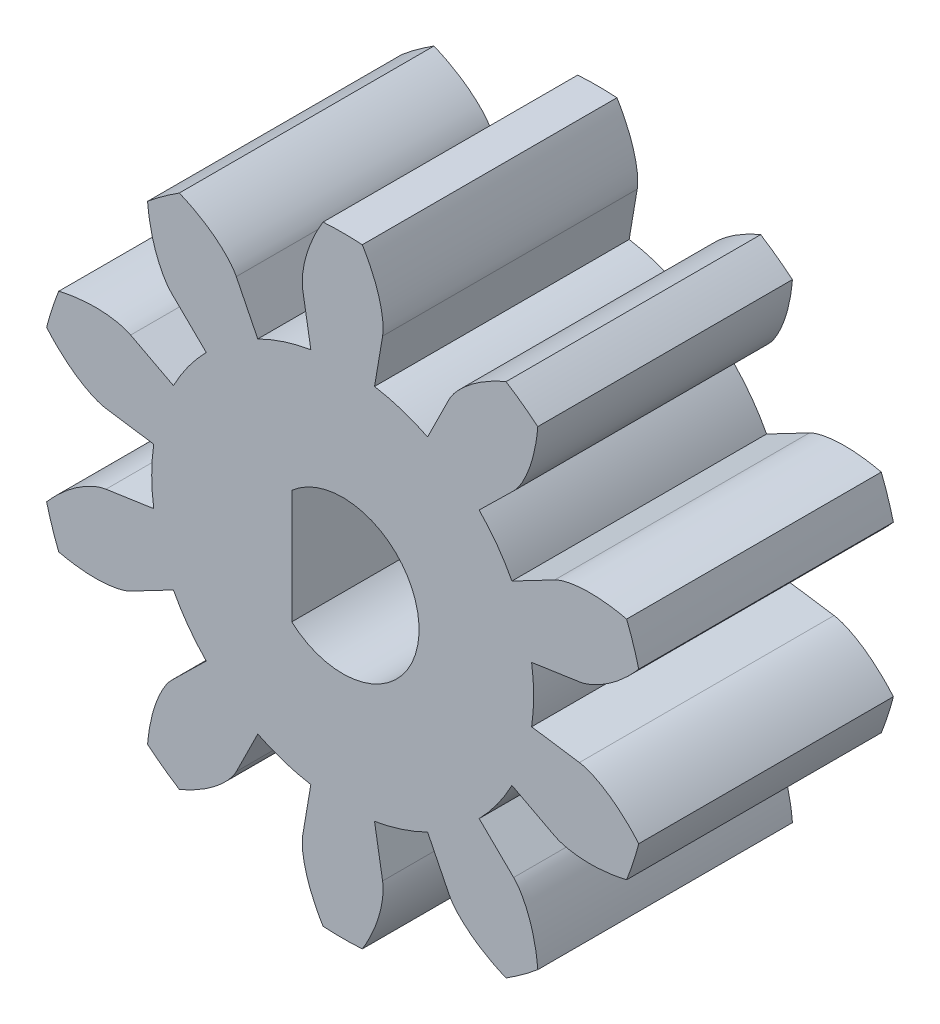
from build123d import *

# Parameters (mm, degrees)
SKETCH_1_R               = 6
SKETCH_1_R_2             = 1.25
EXTRUDE_1_DEPTH          = 5
CUT_EXTRUDE_1_DEPTH      = 10.848857802
PATTERN_CIRCULAR_1_DEPTH = 5
EXTRUDE_START            = -5
SKETCH_2_R               = 1.25
EXTRUDE_3_DEPTH          = 5
CUT_EXTRUDE_2_DEPTH      = 10.736429646


# Read off the part's stored shape, not the designer's step: 阵列(圆周)1
with BuildPart() as part:
    # 草图1 → 凸台-拉伸1 (new body)
    with BuildSketch(Plane.XY):
        Circle(SKETCH_1_R)
        Circle(SKETCH_1_R_2, mode=Mode.SUBTRACT)
    extrude(amount=EXTRUDE_1_DEPTH)

    # 草图1<3> → 切除-拉伸1 (cut, through all)
    with BuildSketch(Plane.XY):
        with BuildLine():
            Line((4.648088484, 0.686169791), (3.709794337, 0.54765498))
            ThreePointArc((3.709794337, 0.54765498), (3.739935077, 0.274564415), (3.75, 0))
            ThreePointArc((3.75, 0), (3.739935077, -0.274564415), (3.709794337, -0.54765498))
            Line((3.709794337, -0.54765498), (4.648088484, -0.686169791))
            add(Edge.make_bspline(
                [(4.648088484, -0.686169791), (4.683519606, -0.691400277), (4.781309106, -0.713360714), (4.960006956, -0.784137383), (5.231114785, -0.93748748), (5.485686634, -1.139450354), (5.670129672, -1.321731466), (5.782028037, -1.447201978), (5.813609798, -1.483893904)],
                knots=[0, 0, 0, 0, 0, 0.005604068, 0.015718248, 0.029959916, 0.048733667, 0.056327564, 0.056327564, 0.056327564, 0.056327564, 0.056327564], degree=4))
            ThreePointArc((5.813609798, -1.483893904), (5.953220086, -0.74777711), (6, 0))
            ThreePointArc((6, 0), (5.953220086, 0.74777711), (5.813609798, 1.483893904))
            add(Edge.make_bspline(
                [(4.648088484, 0.686169791), (4.683519606, 0.691400277), (4.781309106, 0.713360714), (4.960006956, 0.784137383), (5.231114785, 0.93748748), (5.485686634, 1.139450354), (5.670129672, 1.321731466), (5.782028037, 1.447201978), (5.813609798, 1.483893904)],
                knots=[0, 0, 0, 0, 0, 0.005604068, 0.015718248, 0.029959916, 0.048733667, 0.056327564, 0.056327564, 0.056327564, 0.056327564, 0.056327564], degree=4))
        make_face()
    extrude(amount=CUT_EXTRUDE_1_DEPTH, mode=Mode.SUBTRACT)

    # 阵列(圆周)1 outline → 阵列(圆周)1 (cut)
    with BuildSketch(Plane.XY):
        with BuildLine():
            Line((3.323190185, 1.737500215), (4.163703059, 2.176954841))
            add(Edge.make_bspline(
                [(4.163703059, 2.176954841), (4.195441841, 2.193549179), (4.287463229, 2.233262038), (4.473634309, 2.281038471), (4.783102075, 2.31632882), (5.107765826, 2.302571002), (5.364125528, 2.263515382), (5.528402923, 2.227779814), (5.575520078, 2.216658716)],
                knots=[0, 0, 0, 0, 0, 0.005604068, 0.015718248, 0.029959916, 0.048733667, 0.056327564, 0.056327564, 0.056327564, 0.056327564, 0.056327564], degree=4))
            ThreePointArc((5.575520078, 2.216658716), (4.854101966, 3.526711514), (3.831098172, 4.617649488))
            add(Edge.make_bspline(
                [(3.357062092, 3.287200884), (3.382652068, 3.312258327), (3.448857414, 3.38750392), (3.55182553, 3.549799409), (3.681019445, 3.833215427), (3.768261599, 4.146240403), (3.810337002, 4.402121818), (3.827114964, 4.569401803), (3.831098172, 4.617649488)],
                knots=[0, 0, 0, 0, 0, 0.005604068, 0.015718248, 0.029959916, 0.048733667, 0.056327564, 0.056327564, 0.056327564, 0.056327564, 0.056327564], degree=4))
            Line((3.357062092, 3.287200884), (2.679383144, 2.623624586))
            ThreePointArc((2.679383144, 2.623624586), (3.033813729, 2.204194696), (3.323190185, 1.737500215))
        make_face()
        with BuildLine():
            add(Edge.make_bspline(
                [(3.357062092, -3.287200884), (3.382652068, -3.312258327), (3.448857414, -3.38750392), (3.55182553, -3.549799409), (3.681019445, -3.833215427), (3.768261599, -4.146240403), (3.810337002, -4.402121818), (3.827114964, -4.569401803), (3.831098172, -4.617649488)],
                knots=[0, 0, 0, 0, 0, 0.005604068, 0.015718248, 0.029959916, 0.048733667, 0.056327564, 0.056327564, 0.056327564, 0.056327564, 0.056327564], degree=4))
            ThreePointArc((3.831098172, -4.617649488), (4.854101966, -3.526711514), (5.575520078, -2.216658716))
            add(Edge.make_bspline(
                [(4.163703059, -2.176954841), (4.195441841, -2.193549179), (4.287463229, -2.233262038), (4.473634309, -2.281038471), (4.783102075, -2.31632882), (5.107765826, -2.302571002), (5.364125528, -2.263515382), (5.528402923, -2.227779814), (5.575520078, -2.216658716)],
                knots=[0, 0, 0, 0, 0, 0.005604068, 0.015718248, 0.029959916, 0.048733667, 0.056327564, 0.056327564, 0.056327564, 0.056327564, 0.056327564], degree=4))
            Line((4.163703059, -2.176954841), (3.323190185, -1.737500215))
            ThreePointArc((3.323190185, -1.737500215), (3.033813729, -2.204194696), (2.679383144, -2.623624586))
            Line((2.679383144, -2.623624586), (3.357062092, -3.287200884))
        make_face()
        with BuildLine():
            add(Edge.make_bspline(
                [(0.783752082, -4.632632968), (0.789726412, -4.667946276), (0.799059413, -4.767735765), (0.786967474, -4.959558713), (0.724899791, -5.264785367), (0.611488712, -5.569307543), (0.495125105, -5.801051258), (0.410374054, -5.946245447), (0.385237259, -5.987619916)],
                knots=[0, 0, 0, 0, 0, 0.005604068, 0.015718248, 0.029959916, 0.048733667, 0.056327564, 0.056327564, 0.056327564, 0.056327564, 0.056327564], degree=4))
            ThreePointArc((0.385237259, -5.987619916), (1.854101966, -5.706339098), (3.207771193, -5.070523047))
            add(Edge.make_bspline(
                [(2.088924584, -4.208556715), (2.104847891, -4.240637405), (2.155952125, -4.326854598), (2.278485409, -4.474935159), (2.508106945, -4.68538624), (2.77885208, -4.865088496), (3.009207752, -4.984176288), (3.163115797, -5.051825436), (3.207771193, -5.070523047)],
                knots=[0, 0, 0, 0, 0, 0.005604068, 0.015718248, 0.029959916, 0.048733667, 0.056327564, 0.056327564, 0.056327564, 0.056327564, 0.056327564], degree=4))
            Line((2.088924584, -4.208556715), (1.667240333, -3.358989383))
            ThreePointArc((1.667240333, -3.358989383), (1.158813729, -3.566461936), (0.625538659, -3.697458774))
            Line((0.625538659, -3.697458774), (0.783752082, -4.632632968))
        make_face()
        with BuildLine():
            add(Edge.make_bspline(
                [(-2.088924584, -4.208556715), (-2.104847891, -4.240637405), (-2.155952125, -4.326854598), (-2.278485409, -4.474935159), (-2.508106945, -4.68538624), (-2.77885208, -4.865088496), (-3.009207752, -4.984176288), (-3.163115797, -5.051825436), (-3.207771193, -5.070523047)],
                knots=[0, 0, 0, 0, 0, 0.005604068, 0.015718248, 0.029959916, 0.048733667, 0.056327564, 0.056327564, 0.056327564, 0.056327564, 0.056327564], degree=4))
            ThreePointArc((-3.207771193, -5.070523047), (-1.854101966, -5.706339098), (-0.385237259, -5.987619916))
            add(Edge.make_bspline(
                [(-0.783752082, -4.632632968), (-0.789726412, -4.667946276), (-0.799059413, -4.767735765), (-0.786967474, -4.959558713), (-0.724899791, -5.264785367), (-0.611488712, -5.569307543), (-0.495125105, -5.801051258), (-0.410374054, -5.946245447), (-0.385237259, -5.987619916)],
                knots=[0, 0, 0, 0, 0, 0.005604068, 0.015718248, 0.029959916, 0.048733667, 0.056327564, 0.056327564, 0.056327564, 0.056327564, 0.056327564], degree=4))
            Line((-0.783752082, -4.632632968), (-0.625538659, -3.697458774))
            ThreePointArc((-0.625538659, -3.697458774), (-1.158813729, -3.566461936), (-1.667240333, -3.358989383))
            Line((-1.667240333, -3.358989383), (-2.088924584, -4.208556715))
        make_face()
        with BuildLine():
            add(Edge.make_bspline(
                [(-4.163703059, -2.176954841), (-4.195441841, -2.193549179), (-4.287463229, -2.233262038), (-4.473634309, -2.281038471), (-4.783102075, -2.31632882), (-5.107765826, -2.302571002), (-5.364125528, -2.263515382), (-5.528402923, -2.227779814), (-5.575520078, -2.216658716)],
                knots=[0, 0, 0, 0, 0, 0.005604068, 0.015718248, 0.029959916, 0.048733667, 0.056327564, 0.056327564, 0.056327564, 0.056327564, 0.056327564], degree=4))
            ThreePointArc((-5.575520078, -2.216658716), (-4.854101966, -3.526711514), (-3.831098172, -4.617649488))
            add(Edge.make_bspline(
                [(-3.357062092, -3.287200884), (-3.382652068, -3.312258327), (-3.448857414, -3.38750392), (-3.55182553, -3.549799409), (-3.681019445, -3.833215427), (-3.768261599, -4.146240403), (-3.810337002, -4.402121818), (-3.827114964, -4.569401803), (-3.831098172, -4.617649488)],
                knots=[0, 0, 0, 0, 0, 0.005604068, 0.015718248, 0.029959916, 0.048733667, 0.056327564, 0.056327564, 0.056327564, 0.056327564, 0.056327564], degree=4))
            Line((-3.357062092, -3.287200884), (-2.679383144, -2.623624586))
            ThreePointArc((-2.679383144, -2.623624586), (-3.033813729, -2.204194696), (-3.323190185, -1.737500215))
            Line((-3.323190185, -1.737500215), (-4.163703059, -2.176954841))
        make_face()
        with BuildLine():
            add(Edge.make_bspline(
                [(-4.648088484, 0.686169791), (-4.683519606, 0.691400277), (-4.781309106, 0.713360714), (-4.960006956, 0.784137383), (-5.231114785, 0.93748748), (-5.485686634, 1.139450354), (-5.670129672, 1.321731466), (-5.782028037, 1.447201978), (-5.813609798, 1.483893904)],
                knots=[0, 0, 0, 0, 0, 0.005604068, 0.015718248, 0.029959916, 0.048733667, 0.056327564, 0.056327564, 0.056327564, 0.056327564, 0.056327564], degree=4))
            ThreePointArc((-5.813609798, 1.483893904), (-6, 0), (-5.813609798, -1.483893904))
            add(Edge.make_bspline(
                [(-4.648088484, -0.686169791), (-4.683519606, -0.691400277), (-4.781309106, -0.713360714), (-4.960006956, -0.784137383), (-5.231114785, -0.93748748), (-5.485686634, -1.139450354), (-5.670129672, -1.321731466), (-5.782028037, -1.447201978), (-5.813609798, -1.483893904)],
                knots=[0, 0, 0, 0, 0, 0.005604068, 0.015718248, 0.029959916, 0.048733667, 0.056327564, 0.056327564, 0.056327564, 0.056327564, 0.056327564], degree=4))
            Line((-4.648088484, -0.686169791), (-3.709794337, -0.54765498))
            ThreePointArc((-3.709794337, -0.54765498), (-3.75, 0), (-3.709794337, 0.54765498))
            Line((-3.709794337, 0.54765498), (-4.648088484, 0.686169791))
        make_face()
        with BuildLine():
            add(Edge.make_bspline(
                [(-3.357062092, 3.287200884), (-3.382652068, 3.312258327), (-3.448857414, 3.38750392), (-3.55182553, 3.549799409), (-3.681019445, 3.833215427), (-3.768261599, 4.146240403), (-3.810337002, 4.402121818), (-3.827114964, 4.569401803), (-3.831098172, 4.617649488)],
                knots=[0, 0, 0, 0, 0, 0.005604068, 0.015718248, 0.029959916, 0.048733667, 0.056327564, 0.056327564, 0.056327564, 0.056327564, 0.056327564], degree=4))
            ThreePointArc((-3.831098172, 4.617649488), (-4.854101966, 3.526711514), (-5.575520078, 2.216658716))
            add(Edge.make_bspline(
                [(-4.163703059, 2.176954841), (-4.195441841, 2.193549179), (-4.287463229, 2.233262038), (-4.473634309, 2.281038471), (-4.783102075, 2.31632882), (-5.107765826, 2.302571002), (-5.364125528, 2.263515382), (-5.528402923, 2.227779814), (-5.575520078, 2.216658716)],
                knots=[0, 0, 0, 0, 0, 0.005604068, 0.015718248, 0.029959916, 0.048733667, 0.056327564, 0.056327564, 0.056327564, 0.056327564, 0.056327564], degree=4))
            Line((-4.163703059, 2.176954841), (-3.323190185, 1.737500215))
            ThreePointArc((-3.323190185, 1.737500215), (-3.033813729, 2.204194696), (-2.679383144, 2.623624586))
            Line((-2.679383144, 2.623624586), (-3.357062092, 3.287200884))
        make_face()
        with BuildLine():
            add(Edge.make_bspline(
                [(-0.783752082, 4.632632968), (-0.789726412, 4.667946276), (-0.799059413, 4.767735765), (-0.786967474, 4.959558713), (-0.724899791, 5.264785367), (-0.611488712, 5.569307543), (-0.495125105, 5.801051258), (-0.410374054, 5.946245447), (-0.385237259, 5.987619916)],
                knots=[0, 0, 0, 0, 0, 0.005604068, 0.015718248, 0.029959916, 0.048733667, 0.056327564, 0.056327564, 0.056327564, 0.056327564, 0.056327564], degree=4))
            ThreePointArc((-0.385237259, 5.987619916), (-1.854101966, 5.706339098), (-3.207771193, 5.070523047))
            add(Edge.make_bspline(
                [(-2.088924584, 4.208556715), (-2.104847891, 4.240637405), (-2.155952125, 4.326854598), (-2.278485409, 4.474935159), (-2.508106945, 4.68538624), (-2.77885208, 4.865088496), (-3.009207752, 4.984176288), (-3.163115797, 5.051825436), (-3.207771193, 5.070523047)],
                knots=[0, 0, 0, 0, 0, 0.005604068, 0.015718248, 0.029959916, 0.048733667, 0.056327564, 0.056327564, 0.056327564, 0.056327564, 0.056327564], degree=4))
            Line((-2.088924584, 4.208556715), (-1.667240333, 3.358989383))
            ThreePointArc((-1.667240333, 3.358989383), (-1.158813729, 3.566461936), (-0.625538659, 3.697458774))
            Line((-0.625538659, 3.697458774), (-0.783752082, 4.632632968))
        make_face()
        with BuildLine():
            add(Edge.make_bspline(
                [(2.088924584, 4.208556715), (2.104847891, 4.240637405), (2.155952125, 4.326854598), (2.278485409, 4.474935159), (2.508106945, 4.68538624), (2.77885208, 4.865088496), (3.009207752, 4.984176288), (3.163115797, 5.051825436), (3.207771193, 5.070523047)],
                knots=[0, 0, 0, 0, 0, 0.005604068, 0.015718248, 0.029959916, 0.048733667, 0.056327564, 0.056327564, 0.056327564, 0.056327564, 0.056327564], degree=4))
            ThreePointArc((3.207771193, 5.070523047), (1.854101966, 5.706339098), (0.385237259, 5.987619916))
            add(Edge.make_bspline(
                [(0.783752082, 4.632632968), (0.789726412, 4.667946276), (0.799059413, 4.767735765), (0.786967474, 4.959558713), (0.724899791, 5.264785367), (0.611488712, 5.569307543), (0.495125105, 5.801051258), (0.410374054, 5.946245447), (0.385237259, 5.987619916)],
                knots=[0, 0, 0, 0, 0, 0.005604068, 0.015718248, 0.029959916, 0.048733667, 0.056327564, 0.056327564, 0.056327564, 0.056327564, 0.056327564], degree=4))
            Line((0.783752082, 4.632632968), (0.625538659, 3.697458774))
            ThreePointArc((0.625538659, 3.697458774), (1.158813729, 3.566461936), (1.667240333, 3.358989383))
            Line((1.667240333, 3.358989383), (2.088924584, 4.208556715))
        make_face()
    extrude(amount=PATTERN_CIRCULAR_1_DEPTH, mode=Mode.SUBTRACT)

    # 草图2 → 凸台-拉伸3 (add)
    with BuildSketch(Plane.XY.offset(5).offset(EXTRUDE_START)):
        Circle(SKETCH_2_R)
    extrude(amount=EXTRUDE_3_DEPTH)

    # 草图3 → 切除-拉伸2 (cut, through all)
    with BuildSketch(Plane(origin=(0, 0, 0), x_dir=(-1, 0, 0), z_dir=(0, 0, -1))):
        with BuildLine():
            Line((1, -1.118033989), (1, 1.118033989))
            ThreePointArc((1, 1.118033989), (-1.5, 0), (1, -1.118033989))
        make_face()
    extrude(amount=-CUT_EXTRUDE_2_DEPTH, mode=Mode.SUBTRACT)


solid = part.part
